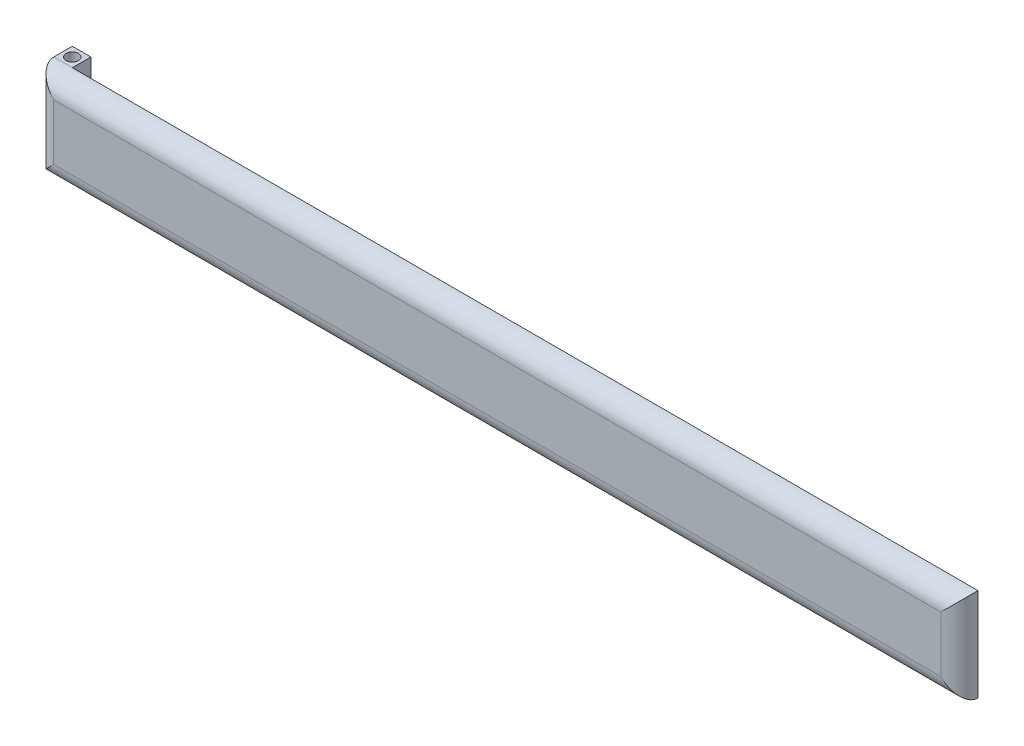
from build123d import *

# Parameters (mm, degrees)
SKETCH_1_W          = 3
SKETCH_1_H          = 15
EXTRUDE_1_DEPTH     = 6
SKETCH_2_W          = 3
SKETCH_2_H          = 15
EXTRUDE_2_DEPTH     = 146
SKETCH_3_R          = 1
CUT_EXTRUDE_1_DEPTH = 146
FILLET_1_R          = 3


with BuildPart() as part:
    # 草图1 → 凸台-拉伸1 (new body)
    with BuildSketch(Plane.XY):
        Rectangle(SKETCH_1_W, SKETCH_1_H)
    extrude(amount=EXTRUDE_1_DEPTH)

    # 草图2 → 凸台-拉伸2 (add)
    with BuildSketch(Plane(origin=(1.5, 0, 0), x_dir=(0, 0, -1), z_dir=(1, 0, 0))):
        with Locations((-4.5, 0)):
            Rectangle(SKETCH_2_W, SKETCH_2_H)
    extrude(amount=EXTRUDE_2_DEPTH)

    # 草图3 → 切除-拉伸1 (cut)
    with BuildSketch(Plane(origin=(0, 7.5, 0), x_dir=(1, 0, 0), z_dir=(0, 1, 0))):
        with Locations(Location((0, -1.5, 0), (0, 0, 270))):
            Circle(SKETCH_3_R)
    extrude(amount=-CUT_EXTRUDE_1_DEPTH, mode=Mode.SUBTRACT)

    # 圆角1
    fillet_1_edges = [part.edges().sort_by_distance(p)[0] for p in [
        (-1.5, 0, 6),
        (73, 7.5, 6),
        (147.5, 0, 6),
        (73, -7.5, 6),
    ]]
    fillet(fillet_1_edges, radius=FILLET_1_R - 0.0001)  # a hair under: the kernel refuses the full size


solid = part.part
